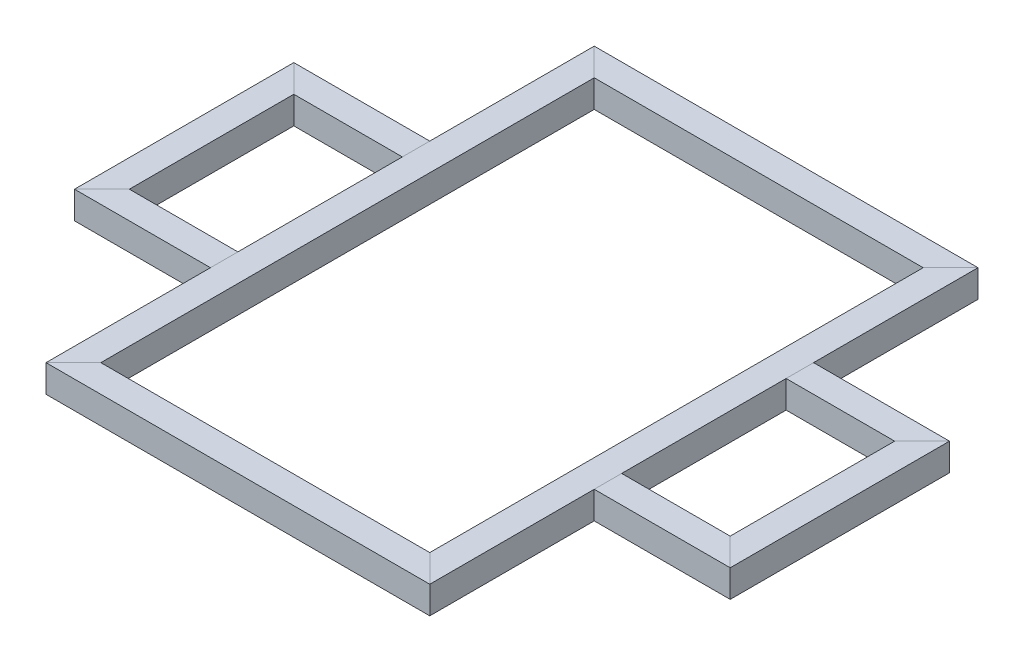
from build123d import *

# Parameters (mm, degrees)
SKETCH1_W             = 25
SKETCH1_H             = 25
SKETCH1_W_2           = 21
SKETCH1_H_2           = 21
BOSS_EXTRUDE1_DEPTH   = 250
BOSS_EXTRUDE1_2_DEPTH = 250
CUT_EXTRUDE1_DEPTH    = 307.186217848
SKETCH3_W             = 25
SKETCH3_H             = 25
SKETCH3_W_2           = 21
SKETCH3_H_2           = 21
BOSS_EXTRUDE2_DEPTH   = 175
BOSS_EXTRUDE2_2_DEPTH = 175
CUT_EXTRUDE2_DEPTH    = 307.186217848
SKETCH5_W             = 25
SKETCH5_H             = 25
SKETCH5_W_2           = 21
SKETCH5_H_2           = 21
BOSS_EXTRUDE3_DEPTH   = 124
BOSS_EXTRUDE3_2_DEPTH = 124
CUT_EXTRUDE3_DEPTH    = 391.545771965
SKETCH7_W             = 25
SKETCH7_H             = 25
SKETCH7_W_2           = 21
SKETCH7_H_2           = 21
BOSS_EXTRUDE4_DEPTH   = 100
CUT_EXTRUDE4_DEPTH    = 391.545771965


with BuildPart() as part:
    # Sketch1 → Boss-Extrude1 (new, symmetric)
    with BuildSketch(Plane.XY):
        with Locations((-162.5, 0)):
            Rectangle(SKETCH1_W, SKETCH1_H)
        with Locations((-162.5, 0)):
            Rectangle(SKETCH1_W_2, SKETCH1_H_2, mode=Mode.SUBTRACT)
    extrude(amount=BOSS_EXTRUDE1_DEPTH, both=True)


with BuildPart() as body_2:
    # Sketch1 → Boss-Extrude1 2 (new, symmetric)
    with BuildSketch(Plane.XY):
        with Locations((162.5, 0)):
            Rectangle(SKETCH1_W, SKETCH1_H)
        with Locations((162.5, 0)):
            Rectangle(SKETCH1_W_2, SKETCH1_H_2, mode=Mode.SUBTRACT)
    extrude(amount=BOSS_EXTRUDE1_2_DEPTH, both=True)


with BuildPart() as cut_extrude1_tool:
    # Sketch2 → Cut-Extrude1 (new, through all)
    with BuildSketch(Plane(origin=(0, 12.5, 0), x_dir=(1, 0, 0), z_dir=(0, 1, 0))):
        Polygon((-175, 250), (-150, 225), (-150, 250), align=None)
        Polygon((175, 250), (150, 225), (150, 250), align=None)
        Polygon((-175, -250), (-150, -225), (-150, -250), align=None)
        Polygon((175, -250), (150, -225), (150, -250), align=None)
    extrude(amount=-CUT_EXTRUDE1_DEPTH)


with BuildPart() as part_1:
    add(part.part)

    # Cut-Extrude1: cut by cut_extrude1_tool
    add(cut_extrude1_tool.part, mode=Mode.SUBTRACT)


with BuildPart() as body_2_1:
    add(body_2.part)

    # Cut-Extrude1: cut by cut_extrude1_tool
    add(cut_extrude1_tool.part, mode=Mode.SUBTRACT)


with BuildPart() as body_3:
    # Sketch3 → Boss-Extrude2 (new, symmetric)
    with BuildSketch(Plane(origin=(0, 0, 0), x_dir=(0, 0, -1), z_dir=(1, 0, 0))):
        with Locations((-237.5, 0)):
            Rectangle(SKETCH3_W, SKETCH3_H)
        with Locations((-237.5, 0)):
            Rectangle(SKETCH3_W_2, SKETCH3_H_2, mode=Mode.SUBTRACT)
    extrude(amount=BOSS_EXTRUDE2_DEPTH, both=True)


with BuildPart() as body_4:
    # Sketch3 → Boss-Extrude2 2 (new, symmetric)
    with BuildSketch(Plane(origin=(0, 0, 0), x_dir=(0, 0, -1), z_dir=(1, 0, 0))):
        with Locations((237.5, 0)):
            Rectangle(SKETCH3_W, SKETCH3_H)
        with Locations((237.5, 0)):
            Rectangle(SKETCH3_W_2, SKETCH3_H_2, mode=Mode.SUBTRACT)
    extrude(amount=BOSS_EXTRUDE2_2_DEPTH, both=True)


with BuildPart() as cut_extrude2_tool:
    # Sketch4 → Cut-Extrude2 (new, through all)
    with BuildSketch(Plane(origin=(0, 12.5, 0), x_dir=(1, 0, 0), z_dir=(0, 1, 0))):
        Polygon((-175, 250), (-175, 225), (-150, 225), align=None)
        Polygon((175, 250), (150, 225), (175, 225), align=None)
        Polygon((175, -225), (175, -250), (150, -225), align=None)
        Polygon((-150, -225), (-175, -250), (-175, -225), align=None)
    extrude(amount=-CUT_EXTRUDE2_DEPTH)


with BuildPart() as body_3_1:
    add(body_3.part)

    # Cut-Extrude2: cut by cut_extrude2_tool
    add(cut_extrude2_tool.part, mode=Mode.SUBTRACT)


with BuildPart() as body_4_1:
    add(body_4.part)

    # Cut-Extrude2: cut by cut_extrude2_tool
    add(cut_extrude2_tool.part, mode=Mode.SUBTRACT)


with BuildPart() as body_5:
    # Sketch5 → Boss-Extrude3 (new body)
    with BuildSketch(Plane.ZY.offset(175)):
        with Locations((-87.5, 0)):
            Rectangle(SKETCH5_W, SKETCH5_H)
        with Locations((-87.5, 0)):
            Rectangle(SKETCH5_W_2, SKETCH5_H_2, mode=Mode.SUBTRACT)
    extrude(amount=BOSS_EXTRUDE3_DEPTH)


with BuildPart() as body_6:
    # Sketch5 → Boss-Extrude3 2 (new body)
    with BuildSketch(Plane.ZY.offset(175)):
        with Locations((87.5, 0)):
            Rectangle(SKETCH5_W, SKETCH5_H)
        with Locations((87.5, 0)):
            Rectangle(SKETCH5_W_2, SKETCH5_H_2, mode=Mode.SUBTRACT)
    extrude(amount=BOSS_EXTRUDE3_2_DEPTH)


with BuildPart() as cut_extrude3_tool:
    # Sketch6 → Cut-Extrude3 (new, through all)
    with BuildSketch(Plane(origin=(0, 12.5, 0), x_dir=(1, 0, 0), z_dir=(0, 1, 0))):
        Polygon((-299, 100), (-299, 75), (-274, 75), align=None)
        Polygon((-299, -100), (-299, -75), (-274, -75), align=None)
    extrude(amount=-CUT_EXTRUDE3_DEPTH)


with BuildPart() as body_5_1:
    add(body_5.part)

    # Cut-Extrude3: cut by cut_extrude3_tool
    add(cut_extrude3_tool.part, mode=Mode.SUBTRACT)


with BuildPart() as body_6_1:
    add(body_6.part)

    # Cut-Extrude3: cut by cut_extrude3_tool
    add(cut_extrude3_tool.part, mode=Mode.SUBTRACT)


with BuildPart() as body_7:
    # Sketch7 → Boss-Extrude4 (new, symmetric)
    with BuildSketch(Plane.XY):
        with Locations((-286.5, 0)):
            Rectangle(SKETCH7_W, SKETCH7_H)
        with Locations((-286.5, 0)):
            Rectangle(SKETCH7_W_2, SKETCH7_H_2, mode=Mode.SUBTRACT)
    extrude(amount=BOSS_EXTRUDE4_DEPTH, both=True)

    # Sketch8 → Cut-Extrude4 (cut, through all)
    with BuildSketch(Plane(origin=(0, 12.5, 0), x_dir=(1, 0, 0), z_dir=(0, 1, 0))):
        Polygon((-299, 100), (-274, 75), (-274, 100), align=None)
        Polygon((-274, -75), (-274, -100), (-299, -100), align=None)
    extrude(amount=-CUT_EXTRUDE4_DEPTH, mode=Mode.SUBTRACT)


with BuildPart() as body_8:
    # Mirror1: mirrored copy
    add(body_5_1.part.mirror(Plane(origin=(0, 0, 0), x_dir=(0, 0, 1), z_dir=(1, 0, 0))))


with BuildPart() as body_9:
    # Mirror1 2: mirrored copy
    add(body_7.part.mirror(Plane(origin=(0, 0, 0), x_dir=(0, 0, 1), z_dir=(1, 0, 0))))


with BuildPart() as body_10:
    # Mirror1 3: mirrored copy
    add(body_6_1.part.mirror(Plane(origin=(0, 0, 0), x_dir=(0, 0, 1), z_dir=(1, 0, 0))))


solid = Compound([part_1.part, body_2_1.part, body_3_1.part, body_4_1.part, body_5_1.part, body_6_1.part, body_7.part, body_8.part, body_9.part, body_10.part])
